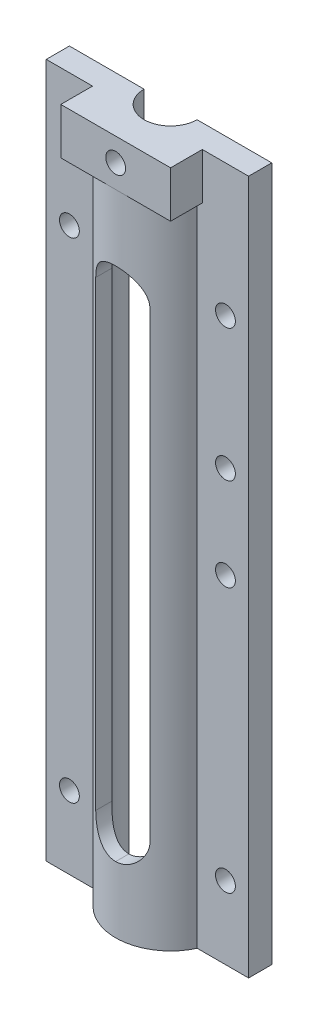
from build123d import *

# Parameters (mm, degrees)
SKETCH1_R                = 8.3
SKETCH1_R_2              = 6.3
BOSS_EXTRUDE1_DEPTH      = 95
SKETCH3_R                = 8.3
BOSS_EXTRUDE2_DEPTH      = 3
SKETCH5_W                = 16.6
SKETCH5_H                = 16.6
BOSS_EXTRUDE4_DEPTH      = 7
CUT_EXTRUDE1_DEPTH       = 107.627623063
FILLET1_R                = 4.1
SKETCH4_R                = 6.3
SKETCH4_R_2              = 1.5
CUT_EXTRUDE3_DEPTH       = 3
BOSS_EXTRUDE6_START      = 2
SKETCH8_R                = 1.5
BOSS_EXTRUDE6_DEPTH      = 2
BOSS_EXTRUDE7_START      = -0.774045
BOSS_EXTRUDE7_DEPTH      = 7.774045
F_3_0_3_DIAMETER_HOLE1_D = 3
F_3_0_3_DIAMETER_HOLE2_D = 3
F_3_0_3_DIAMETER_HOLE3_D = 3
CUT_EXTRUDE4_START       = -105
CUT_EXTRUDE4_DEPTH       = 105


# Read off the part's stored shape, not the designer's step: Cut-Extrude4
with BuildPart() as part:
    # Sketch1 → Boss-Extrude1 (new body)
    with BuildSketch(Plane(origin=(0, 0, 0), x_dir=(1, 0, 0), z_dir=(0, 1, 0))):
        with Locations(Location((0, 0, 0), (0, 0, 270))):
            Circle(SKETCH1_R)
        with Locations(Location((0, 0, 0), (0, 0, 270))):
            Circle(SKETCH1_R_2, mode=Mode.SUBTRACT)
    extrude(amount=BOSS_EXTRUDE1_DEPTH)

    # Sketch3 → Boss-Extrude2 (add)
    with BuildSketch(Plane(origin=(0, 95, 0), x_dir=(1, 0, 0), z_dir=(0, 1, 0))):
        with Locations(Location((0, 0, 0), (0, 0, 270))):
            Circle(SKETCH3_R)
    extrude(amount=BOSS_EXTRUDE2_DEPTH)

    # Sketch5 → Boss-Extrude4 (add)
    with BuildSketch(Plane(origin=(0, 98, 0), x_dir=(1, 0, 0), z_dir=(0, 1, 0))):
        Rectangle(SKETCH5_W, SKETCH5_H)
    extrude(amount=BOSS_EXTRUDE4_DEPTH)

    # Sketch6 → Cut-Extrude1 (cut, through all)
    with BuildSketch(Plane.XY.offset(8.3)):
        Polygon((4.1, 10), (0, 10), (-4.1, 10), (-4.1, 88), (4.1, 88), align=None)
    extrude(amount=-CUT_EXTRUDE1_DEPTH, mode=Mode.SUBTRACT)

    # Fillet1
    fillet1_edges = [part.edges().sort_by_distance(p)[0] for p in [
        (4.1, 88, 5.999975859),
        (4.1, 88, -5.999975859),
        (-4.1, 88, 5.999975859),
        (-4.1, 88, -5.999975859),
        (4.1, 10, -5.999975859),
        (4.1, 10, 5.999975859),
        (-4.1, 10, -5.999975859),
        (-4.1, 10, 5.999975859),
    ]]
    fillet(fillet1_edges, radius=FILLET1_R - 0.0001)  # a hair under: the kernel refuses the full size

    # Sketch4 → Cut-Extrude3 (cut)
    with BuildSketch(Plane(origin=(0, 95, 0), x_dir=(-1, 0, 0), z_dir=(0, -1, 0))):
        with Locations(Location((0, 0, 0), (0, 0, 90))):
            Circle(SKETCH4_R)
        with Locations(Location((0, 0, 0), (0, 0, 90))):
            Circle(SKETCH4_R_2, mode=Mode.SUBTRACT)
    extrude(amount=-CUT_EXTRUDE3_DEPTH, mode=Mode.SUBTRACT)

    # Sketch8 → Boss-Extrude6 (add)
    with BuildSketch(Plane(origin=(0, 95, 0), x_dir=(-1, 0, 0), z_dir=(0, -1, 0)).offset(BOSS_EXTRUDE6_START)):
        with Locations(Location((0, 0, 0), (0, 0, 90))):
            Circle(SKETCH8_R)
    extrude(amount=-BOSS_EXTRUDE6_DEPTH)

    # Sketch9 → Boss-Extrude7 (add)
    with BuildSketch(Plane.ZY.offset(8.3).offset(BOSS_EXTRUDE7_START)):
        Polygon((0, 0), (3.5, 0), (3.5, 105), (-3.5, 105), (-3.5, 0), align=None)
    boss_extrude7 = extrude(amount=BOSS_EXTRUDE7_DEPTH)

    # Mirror1: Boss-Extrude7 across plane
    add(boss_extrude7.mirror(Plane(origin=(0, 0, 0), x_dir=(0, 0, 1), z_dir=(1, 0, 0))))

    # Ø3.0 (3) Diameter Hole1 (through all)
    with Locations(Plane.XY.offset(8.3)):
        with Locations((0, 101.5)):
            Hole(F_3_0_3_DIAMETER_HOLE1_D / 2)

    # Ø3.0 (3) Diameter Hole2 (through all)
    with Locations(Plane.XY.offset(3.5)):
        with Locations((11.8, 85), (11.8, 11)):
            f_3_0_3_diameter_hole2 = Hole(F_3_0_3_DIAMETER_HOLE2_D / 2)

    # Ø3.0 (3) Diameter Hole3 (through all)
    with Locations(Plane(origin=(0, 0, -3.5), x_dir=(-1, 0, 0), z_dir=(0, 0, -1))):
        with Locations((-11.8, 65), (-11.8, 51)):
            Hole(F_3_0_3_DIAMETER_HOLE3_D / 2)

    # Mirror2: Ø3.0 (3) Diameter Hole2 across plane
    add(f_3_0_3_diameter_hole2.mirror(Plane(origin=(0, 0, 0), x_dir=(0, 0, 1), z_dir=(1, 0, 0))), mode=Mode.SUBTRACT)

    # Cut-Extrude4 outline → Cut-Extrude4 (cut)
    with BuildSketch(Plane(origin=(0, 0, 0), x_dir=(-1, 0, 0), z_dir=(0, -1, 0)).offset(CUT_EXTRUDE4_START)):
        with BuildLine():
            ThreePointArc((-4, 0), (0, -4), (4, 0))
            Line((4, 0), (15.3, 0))
            Line((15.3, 0), (15.3, 3.5))
            Line((15.3, 3.5), (8.3, 3.5))
            Line((8.3, 3.5), (8.3, 8.3))
            Line((8.3, 8.3), (-8.3, 8.3))
            Line((-8.3, 8.3), (-8.3, 3.5))
            Line((-8.3, 3.5), (-15.3, 3.5))
            Line((-15.3, 3.5), (-15.3, 0))
            Line((-15.3, 0), (-4, 0))
        make_face()
    extrude(amount=CUT_EXTRUDE4_DEPTH, mode=Mode.SUBTRACT)


solid = part.part
